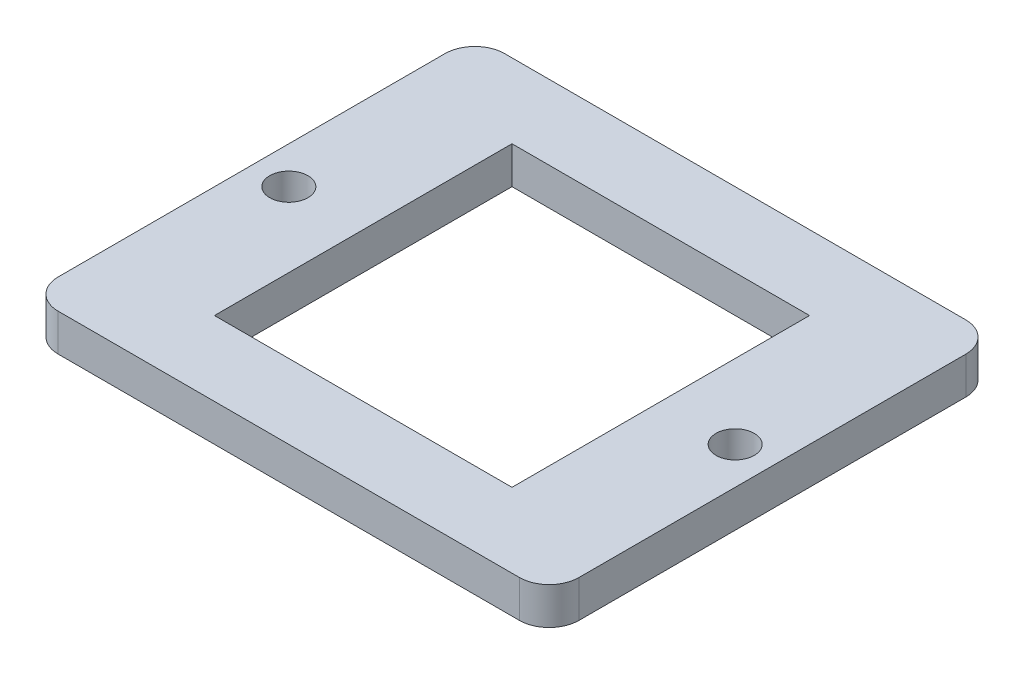
from build123d import *

# Parameters (mm, degrees)
SKETCH1_W                 = 44.45
SKETCH1_H                 = 38.1
BOSS_EXTRUDE1_DEPTH       = 3.175
SKETCH2_W                 = 25.4
SKETCH2_H                 = 25.4
CUT_EXTRUDE1_DEPTH        = 3.175
F_4_CLEARANCE_HOLE1_D     = 3.2639
F_4_CLEARANCE_HOLE1_DEPTH = 10.16
F_4_CLEARANCE_HOLE1_TIP   = 0.980574487
FILLET1_R                 = 2.54


with BuildPart() as part:
    # Sketch1 → Boss-Extrude1 (new body)
    with BuildSketch(Plane(origin=(0, 0, 0), x_dir=(1, 0, 0), z_dir=(0, 1, 0))):
        Rectangle(SKETCH1_W, SKETCH1_H)
    extrude(amount=BOSS_EXTRUDE1_DEPTH)

    # Sketch2 → Cut-Extrude1 (cut)
    with BuildSketch(Plane(origin=(0, 3.175, 0), x_dir=(1, 0, 0), z_dir=(0, 1, 0))):
        Rectangle(SKETCH2_W, SKETCH2_H)
    extrude(amount=-CUT_EXTRUDE1_DEPTH, mode=Mode.SUBTRACT)

    # #4 Clearance Hole1
    with Locations(Plane(origin=(0, 3.175, 0), x_dir=(1, 0, 0), z_dir=(0, 1, 0))):
        with Locations((-19.05, 0), (19.05, 0)):
            Hole(F_4_CLEARANCE_HOLE1_D / 2, depth=F_4_CLEARANCE_HOLE1_DEPTH)
            with Locations((0, 0, -(F_4_CLEARANCE_HOLE1_DEPTH + F_4_CLEARANCE_HOLE1_TIP / 2))):  # 118° drill point
                Cone(0, F_4_CLEARANCE_HOLE1_D / 2, F_4_CLEARANCE_HOLE1_TIP, mode=Mode.SUBTRACT)

    # Fillet1
    fillet1_edges = [part.edges().sort_by_distance(p)[0] for p in [
        (22.225, 1.5875, 19.05),
        (22.225, 1.5875, -19.05),
        (-22.225, 1.5875, -19.05),
        (-22.225, 1.5875, 19.05),
    ]]
    fillet(fillet1_edges, radius=FILLET1_R)


solid = part.part
